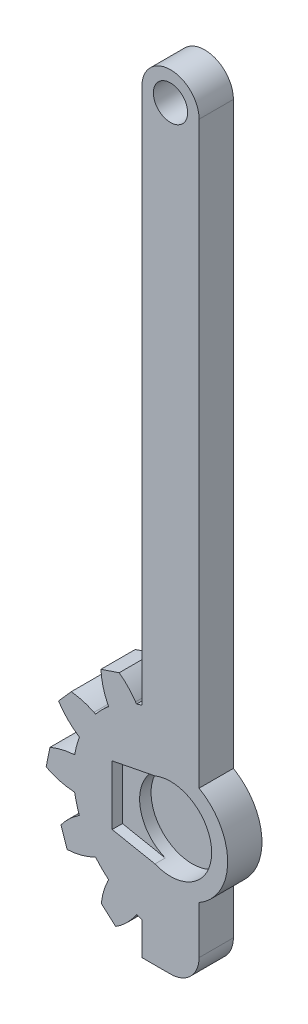
from build123d import *

# Parameters (mm, degrees)
SKETCH1_R           = 1.5
BOSS_EXTRUDE1_DEPTH = 3
CUT_EXTRUDE2_DEPTH  = 0.9
SKETCH5_W           = 3.6
SKETCH5_H           = 3
FILLET1_R           = 2.5


with BuildPart() as part:
    # Sketch1 → Boss-Extrude1 (new body)
    with BuildSketch(Plane.XY.offset(1.9)):
        with BuildLine():
            Line((2.5, -11), (2.5, -4.330127019))
            ThreePointArc((2.5, -4.330127019), (5, 0), (2.5, 4.330127019))
            Line((2.5, 4.330127019), (2.5, 55))
            ThreePointArc((2.5, 55), (0, 57.5), (-2.5, 55))
            Line((-2.5, 55), (-2.5, 8.124038405))
            ThreePointArc((-2.5, 8.124038405), (-2.735010245, 8.047963653), (-2.967710696, 7.965092167))
            Line((-2.967710696, 7.965092167), (-3.054167872, 8.093270203))
            ThreePointArc((-3.054167872, 8.093270203), (-4.342095244, 9.472160372), (-5.994566265, 10.382893341))
            ThreePointArc((-5.994566265, 10.382893341), (-6.032083889, 8.496444973), (-5.481893659, 6.691622066))
            Line((-5.481893659, 6.691622066), (-5.414116812, 6.552658937))
            ThreePointArc((-5.414116812, 6.552658937), (-6.01040764, 6.01040764), (-6.552658937, 5.414116812))
            Line((-6.552658937, 5.414116812), (-6.691622066, 5.481893659))
            ThreePointArc((-6.691622066, 5.481893659), (-8.496444973, 6.032083889), (-10.382893341, 5.994566265))
            ThreePointArc((-10.382893341, 5.994566265), (-9.472160372, 4.342095244), (-8.093270203, 3.054167872))
            Line((-8.093270203, 3.054167872), (-7.965092167, 2.967710696))
            ThreePointArc((-7.965092167, 2.967710696), (-8.210369523, 2.199961883), (-8.381827508, 1.41243323))
            Line((-8.381827508, 1.41243323), (-8.536061531, 1.401648136))
            ThreePointArc((-8.536061531, 1.401648136), (-10.374179133, 0.975715399), (-11.989132531, 0))
            ThreePointArc((-11.989132531, 0), (-10.374179133, -0.975715399), (-8.536061531, -1.401648136))
            Line((-8.536061531, -1.401648136), (-8.381827508, -1.41243323))
            ThreePointArc((-8.381827508, -1.41243323), (-8.210369523, -2.199961883), (-7.965092167, -2.967710696))
            Line((-7.965092167, -2.967710696), (-8.093270203, -3.054167872))
            ThreePointArc((-8.093270203, -3.054167872), (-9.472160372, -4.342095244), (-10.382893341, -5.994566265))
            ThreePointArc((-10.382893341, -5.994566265), (-8.496444973, -6.032083889), (-6.691622066, -5.481893659))
            Line((-6.691622066, -5.481893659), (-6.552658937, -5.414116812))
            ThreePointArc((-6.552658937, -5.414116812), (-6.01040764, -6.01040764), (-5.414116812, -6.552658937))
            Line((-5.414116812, -6.552658937), (-5.481893659, -6.691622066))
            ThreePointArc((-5.481893659, -6.691622066), (-6.032083889, -8.496444973), (-5.994566265, -10.382893341))
            ThreePointArc((-5.994566265, -10.382893341), (-4.342095244, -9.472160372), (-3.054167872, -8.093270203))
            Line((-3.054167872, -8.093270203), (-2.967710696, -7.965092167))
            ThreePointArc((-2.967710696, -7.965092167), (-2.735010245, -8.047963653), (-2.5, -8.124038405))
            Line((-2.5, -8.124038405), (-2.5, -11))
            Line((-2.5, -11), (2.5, -11))
        make_face()
        with Locations((0, 55)):
            Circle(SKETCH1_R, mode=Mode.SUBTRACT)
    extrude(amount=-BOSS_EXTRUDE1_DEPTH)

    # Sketch4 → Cut-Extrude2 (cut)
    with BuildSketch(Plane.XY.offset(1.9)):
        with BuildLine():
            Line((-5.102940329, -2.6), (-1.358771093, -3.333727811))
            ThreePointArc((-1.358771093, -3.333727811), (-3.6, 0), (-1.358771093, 3.333727811))
            Line((-1.358771093, 3.333727811), (-5.102940329, 2.6))
            Line((-5.102940329, 2.6), (-5.102940329, -2.6))
        make_face()
    extrude(amount=-CUT_EXTRUDE2_DEPTH, mode=Mode.SUBTRACT)

    # Sketch5 → Cut-Revolve1 (revolve, cut)
    with BuildSketch(Plane(origin=(0, 0, 0), x_dir=(1, 0, 0), z_dir=(0, 1, 0))):
        with Locations((1.8, -1.5)):
            Rectangle(SKETCH5_W, SKETCH5_H)
    revolve(axis=Axis((0, 0, 0), (0, 0, 1)), mode=Mode.SUBTRACT)

    # Chamfer1
    # the kernel refuses this chamfer: 1.996823512, 1.412365401 mm, written as the material it takes off along each edge
    with BuildSketch(Plane(origin=(-5.994566265, -10.382893341, 6.307600342), x_dir=(0.8971018613245074, 0.44182377754949315, 0), z_dir=(0, 0, -1)), Plane(origin=(-10.382893341, -5.994566265, 6.307600342), x_dir=(0.9978248904640776, -0.06592031530834441, 0), z_dir=(0, 0, -1)), Plane(origin=(-11.989132531, 0, 6.307600342), x_dir=(0.8311815460161414, -0.5560011129145489, 0), z_dir=(0, 0, -1))) as chamfer1_piece_1:
        with BuildLine():
            Line((1.33889649, 0), (0.700148491, -1.556942978))
            ThreePointArc((0.700148491, -1.556942978), (0.305807457, -0.828670891), (0, 0))
            ThreePointArc((0, 0), (0.684607685, 0.037444556), (1.33889649, 0))
        make_face()
    extrude(amount=11.815200684, mode=Mode.SUBTRACT)
    with BuildSketch(Plane(origin=(-10.382893341, 5.994566265, 6.307600342), x_dir=(0.9993864811320993, 0.035023725250178994, 0), z_dir=(0, 0, -1)), Plane(origin=(-5.994566265, 10.382893341, 6.307600342), x_dir=(0.883005943484212, -0.4693618047642527, 0), z_dir=(0, 0, -1))) as chamfer1_piece_2:
        with BuildLine():
            Line((1.707126049, 0), (0.549125448, 1.221108125))
            ThreePointArc((0.549125448, 1.221108125), (0.246629708, 0.639737105), (0, 0))
            ThreePointArc((0, 0), (0.881190909, -0.060960877), (1.707126049, 0))
        make_face()
    extrude(amount=11.815200684, mode=Mode.SUBTRACT)

    # Fillet1
    fillet1_edges = [part.edges().sort_by_distance(p)[0] for p in [
        (2.5, -11, 0.4),
    ]]
    fillet(fillet1_edges, radius=FILLET1_R)


solid = part.part
